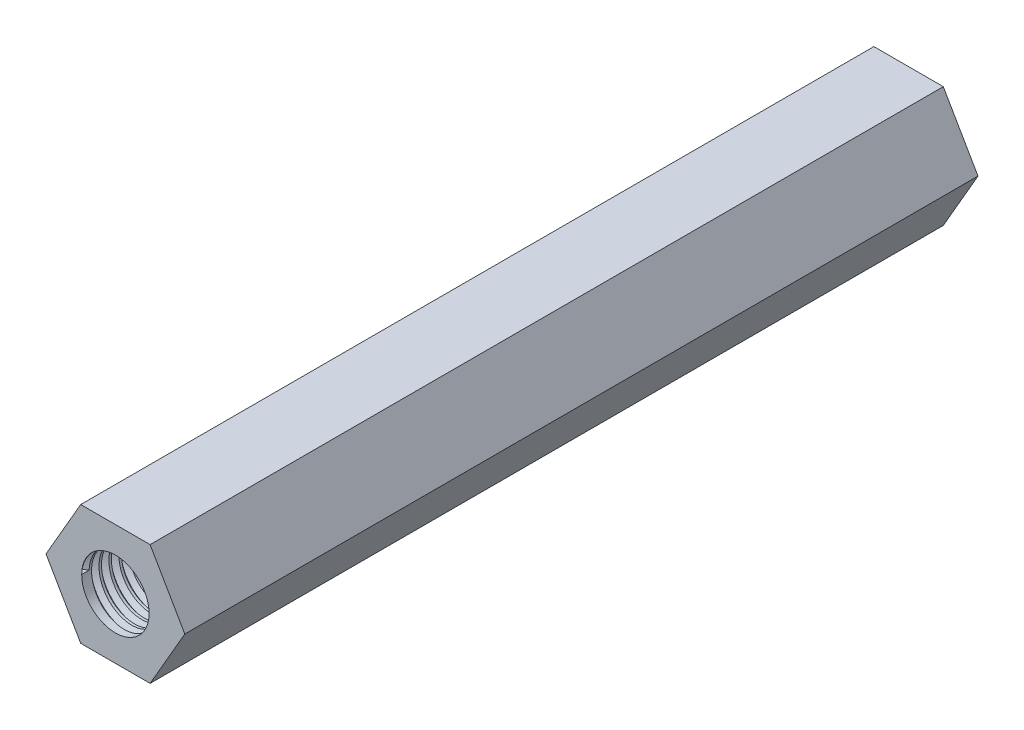
from build123d import *

# Parameters (mm, degrees)
BOSS_EXTRU_1_DEPTH   = 40
D_GAGEMENT_M31_D     = 3.4
D_GAGEMENT_M31_DEPTH = 15
D_GAGEMENT_M31_TIP   = 1.021463052
FILETAGE1_PITCH      = 0.5
D_GAGEMENT_M32_D     = 3.4
D_GAGEMENT_M32_DEPTH = 8
D_GAGEMENT_M32_TIP   = 1.021463052
FILETAGE2_PITCH      = 0.5


with BuildPart() as part:
    # Esquisse1 → Boss.-Extru.1 (new body)
    with BuildSketch(Plane.XY):
        Polygon((5.25, 0.468911087), (7, 3.5), (5.25, 6.531088913), (1.75, 6.531088913), (0, 3.5), (1.75, 0.468911087), align=None)
    extrude(amount=BOSS_EXTRU_1_DEPTH)

    # Dégagement M31
    with Locations(Plane.XY.offset(40)):
        with Locations((3.5, 3.5)):
            Hole(D_GAGEMENT_M31_D / 2, depth=D_GAGEMENT_M31_DEPTH)
            with Locations((0, 0, -(D_GAGEMENT_M31_DEPTH + D_GAGEMENT_M31_TIP / 2))):  # 118° drill point
                Cone(0, D_GAGEMENT_M31_D / 2, D_GAGEMENT_M31_TIP, mode=Mode.SUBTRACT)

    # Filetage1: arcs per turn and ends read off the stored shape
    # Filetage1: the profile of Profil de filetage1 profile screwed along a right-hand helix through 30 turns, 6 arcs to a turn; built about Z, then put on its axis
    filetage1_z = Axis((0, 0, 0), (0, 0, 1))
    filetage1_corners = [(1.6997, 0, -0.000173205), (1.970632937, 0, 0.156249999), (1.970632937, 0, 0.218749999), (1.6997, 0, 0.375173204)]
    with BuildLine(mode=Mode.PRIVATE) as filetage1_profile:
        Line(filetage1_corners[0], filetage1_corners[1])
        Line(filetage1_corners[1], filetage1_corners[2])
        Line(filetage1_corners[2], filetage1_corners[3])
        Line(filetage1_corners[3], filetage1_corners[0])
    filetage1_cap = Face(filetage1_profile.wire())
    filetage1_turn_angles = [0, 30, 60, 90, 120, 150, 180, 210, 240, 270, 300, 330, 360]
    filetage1_turn_weights = [1, 0.8660254037844387, 1, 0.8660254037844387, 1, 0.8660254037844387, 1, 0.8660254037844387, 1, 0.8660254037844387, 1, 0.8660254037844387, 1]
    filetage1_turn_rails = [Edge.make_bspline([Vector(p[0], p[1], 0).rotate(filetage1_z, filetage1_turn_angles[k]) / filetage1_turn_weights[k] + Vector(0, 0, p[2] + FILETAGE1_PITCH * filetage1_turn_angles[k] / 360) for k in range(13)], [0, 0, 0, 1, 1, 2, 2, 3, 3, 4, 4, 5, 5, 6, 6, 6], 2, filetage1_turn_weights) for p in filetage1_corners]
    filetage1_turn_sides = [Face.make_surface_from_curves(filetage1_turn_rails[p[0]], filetage1_turn_rails[p[1]]) for p in [(0, 1), (1, 2), (2, 3), (3, 0)]]
    filetage1 = Plane(origin=(3.5, 3.5, 40), x_dir=(-1, 0, 0), z_dir=(0, 0, -1)) * Solid(Shell([*[p.moved(Location((0, 0, FILETAGE1_PITCH * i))) for i in range(30) for p in filetage1_turn_sides], filetage1_cap, filetage1_cap.rotate(filetage1_z, 10800).moved(Location((0, 0, FILETAGE1_PITCH * 10800 / 360)))]))
    add(filetage1, mode=Mode.SUBTRACT)

    # Dégagement M32
    with Locations(Plane(origin=(0, 0, 0), x_dir=(-1, 0, 0), z_dir=(0, 0, -1))):
        with Locations((-3.5, 3.5)):
            Hole(D_GAGEMENT_M32_D / 2, depth=D_GAGEMENT_M32_DEPTH)
            with Locations((0, 0, -(D_GAGEMENT_M32_DEPTH + D_GAGEMENT_M32_TIP / 2))):  # 118° drill point
                Cone(0, D_GAGEMENT_M32_D / 2, D_GAGEMENT_M32_TIP, mode=Mode.SUBTRACT)

    # Filetage2: arcs per turn and ends read off the stored shape
    # Filetage2: the profile of Profil de filetage2 profile screwed along a right-hand helix through 20 turns, 6 arcs to a turn; built about Z, then put on its axis
    filetage2_z = Axis((0, 0, 0), (0, 0, 1))
    filetage2_corners = [(1.6997, 0, -0.000173205), (1.970632937, 0, 0.156249999), (1.970632937, 0, 0.218749999), (1.6997, 0, 0.375173204)]
    with BuildLine(mode=Mode.PRIVATE) as filetage2_profile:
        Line(filetage2_corners[0], filetage2_corners[1])
        Line(filetage2_corners[1], filetage2_corners[2])
        Line(filetage2_corners[2], filetage2_corners[3])
        Line(filetage2_corners[3], filetage2_corners[0])
    filetage2_cap = Face(filetage2_profile.wire())
    filetage2_turn_angles = [0, 30, 60, 90, 120, 150, 180, 210, 240, 270, 300, 330, 360]
    filetage2_turn_weights = [1, 0.8660254037844387, 1, 0.8660254037844387, 1, 0.8660254037844387, 1, 0.8660254037844387, 1, 0.8660254037844387, 1, 0.8660254037844387, 1]
    filetage2_turn_rails = [Edge.make_bspline([Vector(p[0], p[1], 0).rotate(filetage2_z, filetage2_turn_angles[k]) / filetage2_turn_weights[k] + Vector(0, 0, p[2] + FILETAGE2_PITCH * filetage2_turn_angles[k] / 360) for k in range(13)], [0, 0, 0, 1, 1, 2, 2, 3, 3, 4, 4, 5, 5, 6, 6, 6], 2, filetage2_turn_weights) for p in filetage2_corners]
    filetage2_turn_sides = [Face.make_surface_from_curves(filetage2_turn_rails[p[0]], filetage2_turn_rails[p[1]]) for p in [(0, 1), (1, 2), (2, 3), (3, 0)]]
    filetage2 = Plane(origin=(3.5, 3.5, 0), x_dir=(1, 0, 0), z_dir=(0, 0, 1)) * Solid(Shell([*[p.moved(Location((0, 0, FILETAGE2_PITCH * i))) for i in range(20) for p in filetage2_turn_sides], filetage2_cap, filetage2_cap.rotate(filetage2_z, 7200).moved(Location((0, 0, FILETAGE2_PITCH * 7200 / 360)))]))
    add(filetage2, mode=Mode.SUBTRACT)


solid = part.part
